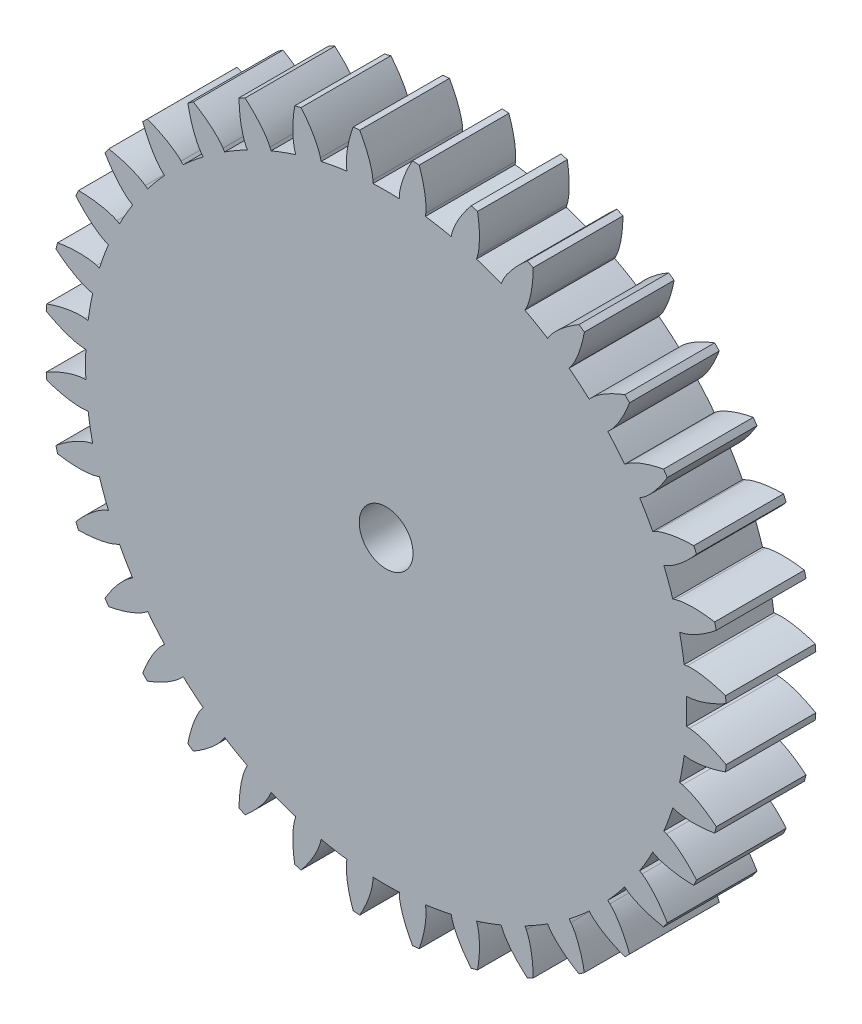
from build123d import *

# Parameters (mm, degrees)
SKETCH_1_R               = 4
SKETCH_1_R_2             = 1.5
EXTRUDE_1_DEPTH          = 5
CUT_EXTRUDE_1_DEPTH      = 8.549834435
PATTERN_CIRCULAR_1_COUNT = 6
PATTERN_CIRCULAR_1_ANGLE = 300
SKETCH_2_R               = 19
SKETCH_2_R_2             = 1.5
EXTRUDE_2_DEPTH          = 5
CUT_EXTRUDE_3_DEPTH      = 28.331300895
PATTERN_CIRCULAR_2_COUNT = 36


with BuildPart() as part:
    # 草图1 → 凸台-拉伸1 (new body)
    with BuildSketch(Plane.XY):
        Circle(SKETCH_1_R)
        Circle(SKETCH_1_R_2, mode=Mode.SUBTRACT)
    extrude(amount=EXTRUDE_1_DEPTH)

    # 草图1<3> → 切除-拉伸1 (cut, through all)
    with BuildSketch(Plane.XY):
        with BuildLine():
            Line((2.730540893, 0.700961074), (1.695038873, 0.435135863))
            ThreePointArc((1.695038873, 0.435135863), (1.736205349, 0.219296571), (1.75, 0))
            ThreePointArc((1.75, 0), (1.736205349, -0.219296571), (1.695038873, -0.435135863))
            Line((1.695038873, -0.435135863), (2.730540893, -0.700961074))
            add(Edge.make_bspline(
                [(2.730540893, -0.700961074), (2.751355068, -0.706304311), (2.808329953, -0.725541446), (2.910522768, -0.778982289), (3.06267796, -0.887491262), (3.235956594, -1.057334282), (3.408810129, -1.2831446), (3.52264255, -1.482702951), (3.589508983, -1.625182096), (3.620975996, -1.699568426)],
                knots=[0, 0, 0, 0, 0, 0.005604068, 0.015718248, 0.029959916, 0.048733667, 0.068727063, 0.089838728, 0.089838728, 0.089838728, 0.089838728, 0.089838728], degree=4))
            ThreePointArc((3.620975996, -1.699568426), (3.90409426, -0.870659525), (4, 0))
            ThreePointArc((4, 0), (3.90409426, 0.870659525), (3.620975996, 1.699568426))
            add(Edge.make_bspline(
                [(2.730540893, 0.700961074), (2.751355068, 0.706304311), (2.808329953, 0.725541446), (2.910522768, 0.778982289), (3.06267796, 0.887491262), (3.235956594, 1.057334282), (3.408810129, 1.2831446), (3.52264255, 1.482702951), (3.589508983, 1.625182096), (3.620975996, 1.699568426)],
                knots=[0, 0, 0, 0, 0, 0.005604068, 0.015718248, 0.029959916, 0.048733667, 0.068727063, 0.089838728, 0.089838728, 0.089838728, 0.089838728, 0.089838728], degree=4))
        make_face()
    cut_extrude_1 = extrude(amount=CUT_EXTRUDE_1_DEPTH, mode=Mode.SUBTRACT)

    # 阵列(圆周)1: 切除-拉伸1 ×6 about axis
    pattern_circular_1_axis = Axis((0, 0, 5), (0, 0, 1))
    for i in range(1, PATTERN_CIRCULAR_1_COUNT):
        add(cut_extrude_1.rotate(pattern_circular_1_axis, i * PATTERN_CIRCULAR_1_ANGLE / (PATTERN_CIRCULAR_1_COUNT - 1)), mode=Mode.SUBTRACT)

    # 草图2 → 凸台-拉伸2 (add)
    with BuildSketch(Plane.XY.offset(5)):
        Circle(SKETCH_2_R)
        Circle(SKETCH_2_R_2, mode=Mode.SUBTRACT)
    extrude(amount=EXTRUDE_2_DEPTH)

    # 草图2<3> → 切除-拉伸3 (cut, through all)
    with BuildSketch(Plane.XY.offset(5)):
        with BuildLine():
            Line((16.898368373, 0.737798697), (16.734057711, 0.730624738))
            ThreePointArc((16.734057711, 0.730624738), (16.746013954, 0.365399324), (16.75, 0))
            ThreePointArc((16.75, 0), (16.746013954, -0.365399324), (16.734057711, -0.730624738))
            Line((16.734057711, -0.730624738), (16.898368373, -0.737798697))
            add(Edge.make_bspline(
                [(16.898368373, -0.737798697), (16.930520209, -0.739202476), (16.994649722, -0.743982378), (17.122212497, -0.761309933), (17.362329857, -0.80938738), (17.679190838, -0.897926374), (18.133290252, -1.063263222), (18.513224702, -1.239582175), (18.780722022, -1.380744048), (18.942863835, -1.472382334)],
                knots=[0, 0, 0, 0, 0, 0.001401017, 0.002802034, 0.005604068, 0.010661158, 0.015718248, 0.023831652, 0.023831652, 0.023831652, 0.023831652, 0.023831652], degree=4))
            ThreePointArc((18.942863835, -1.472382334), (18.985710585, -0.736745254), (19, 0))
            ThreePointArc((19, 0), (18.985710585, 0.736745254), (18.942863835, 1.472382334))
            add(Edge.make_bspline(
                [(16.898368373, 0.737798697), (16.930520209, 0.739202476), (16.994649722, 0.743982378), (17.122212497, 0.761309933), (17.362329857, 0.80938738), (17.679190838, 0.897926374), (18.133290252, 1.063263222), (18.513224702, 1.239582175), (18.780722022, 1.380744048), (18.942863835, 1.472382334)],
                knots=[0, 0, 0, 0, 0, 0.001401017, 0.002802034, 0.005604068, 0.010661158, 0.015718248, 0.023831652, 0.023831652, 0.023831652, 0.023831652, 0.023831652], degree=4))
        make_face()
    cut_extrude_3 = extrude(amount=CUT_EXTRUDE_3_DEPTH, mode=Mode.SUBTRACT)

    # 阵列(圆周)2: 切除-拉伸3 ×36 about axis
    pattern_circular_2_axis = Axis((0, 0, 10), (0, 0, 1))
    for i in range(1, PATTERN_CIRCULAR_2_COUNT):
        add(cut_extrude_3.rotate(pattern_circular_2_axis, i * 360 / PATTERN_CIRCULAR_2_COUNT), mode=Mode.SUBTRACT)


solid = part.part
